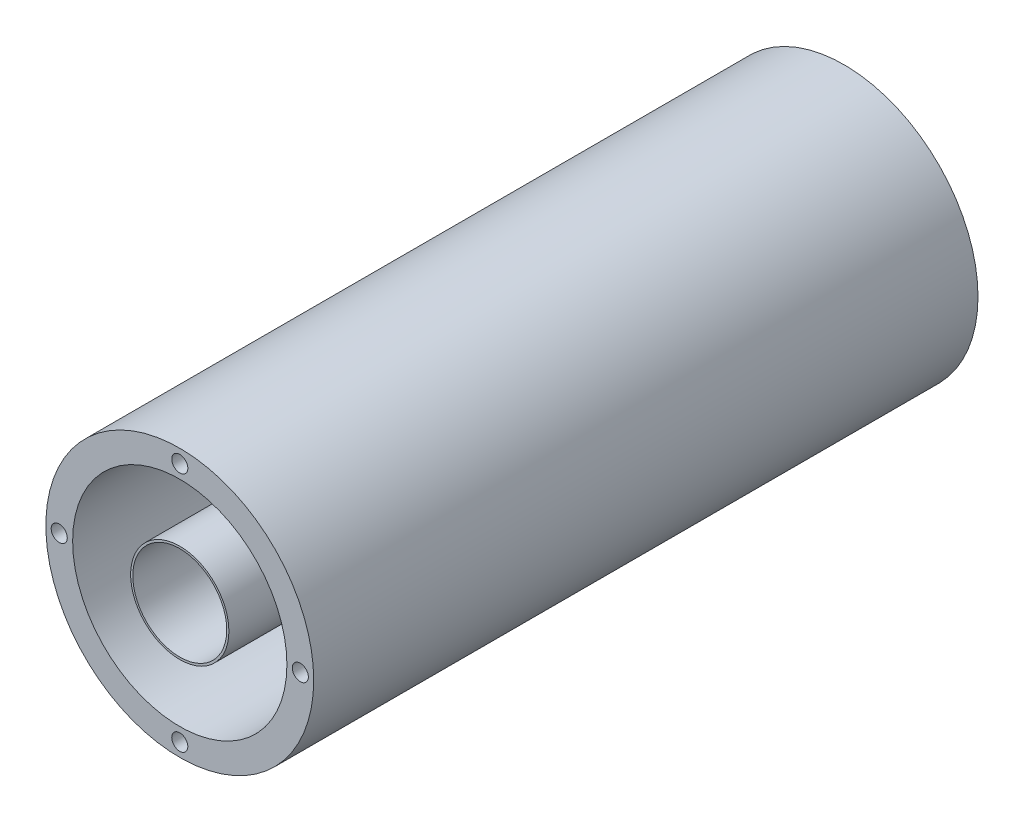
from build123d import *

# Parameters (mm, degrees)
SKETCH1_R               = 25
BOSS_EXTRUDE2_DEPTH     = 124
SKETCH3_R               = 20
CUT_EXTRUDE1_DEPTH      = 120
SKETCH4_W               = 20
SKETCH4_H               = 10
BOSS_EXTRUDE3_DEPTH     = 7
FILLET1_R               = 10
FILLET2_R               = 10
FILLET3_R               = 2
CUT_EXTRUDE2_DEPTH      = 131.003846097
CUT_EXTRUDE2_DEPTH_BACK = 131.003846097
SKETCH5_W               = 10
SKETCH5_H               = 3.1
SKETCH6_R               = 1.5
CUT_EXTRUDE3_DEPTH      = 5
CIRPATTERN1_START       = 119
CIRPATTERN1_OUTLINE_R   = 1.5
CIRPATTERN1_DEPTH       = 5
SKETCH8_R               = 9.170359624
SKETCH8_R_2             = 8.770359624
BOSS_EXTRUDE4_DEPTH     = 119.4


# Read off the part's stored shape, not the designer's step: CirPattern1
with BuildPart() as part:
    # Sketch1 → Boss-Extrude2 (new body)
    with BuildSketch(Plane.XY):
        Circle(SKETCH1_R)
    extrude(amount=BOSS_EXTRUDE2_DEPTH)

    # Sketch3 → Cut-Extrude1 (cut)
    with BuildSketch(Plane.XY.offset(124)):
        Circle(SKETCH3_R)
    extrude(amount=-CUT_EXTRUDE1_DEPTH, mode=Mode.SUBTRACT)

    # Sketch4 → Boss-Extrude3 (add)
    with BuildSketch(Plane(origin=(0, 0, 0), x_dir=(-1, 0, 0), z_dir=(0, 0, -1))):
        Rectangle(SKETCH4_W, SKETCH4_H)
    extrude(amount=BOSS_EXTRUDE3_DEPTH)

    # Fillet1
    # the kernel refuses this fillet: 10 mm, written as the material it adds along each edge
    with BuildSketch(Plane(origin=(-10, 5, 0), x_dir=(-1, 0, 0), z_dir=(0, -1, 0)), Plane(origin=(10, -5, 0), x_dir=(1, 0, 0), z_dir=(0, 1, 0))) as fillet1_piece_1:
        with BuildLine():
            CenterArc((9.539392014, 10), FILLET1_R, 197.457603124, 72.542396876)
            Line((0, 7), (-0.19078784, 6.94))
            ThreePointArc((-0.19078784, 6.94), (-0.2, 3.5), (-0.2, 0))
            Line((-0.2, 0), (0, -0.2))
            Line((0, -0.2), (9.539392014, -0.2))
            Line((9.539392014, -0.2), (9.539392014, 0))
        make_face()
    extrude(amount=10)

    # Fillet2
    fillet2_edges = [part.edges().sort_by_distance(p)[0] for p in [
        (-10, 0, -7),
        (10, 0, -7),
    ]]
    fillet(fillet2_edges, radius=FILLET2_R)

    # Fillet3
    fillet3_edges = [part.edges().sort_by_distance(p)[0] for p in [
        (0, 5, 0),
        (0, -5, 0),
    ]]
    fillet(fillet3_edges, radius=FILLET3_R)

    # Sketch5 → Cut-Extrude2 (cut, two sides: drawn at the far end of the back side and taken through both)
    with BuildSketch(Plane(origin=(0, 5, 0), x_dir=(1, 0, 0), z_dir=(0, 1, 0)).offset(-CUT_EXTRUDE2_DEPTH_BACK)):
        with Locations((0, 1.55)):
            Rectangle(SKETCH5_W, SKETCH5_H)
    extrude(amount=CUT_EXTRUDE2_DEPTH + CUT_EXTRUDE2_DEPTH_BACK, mode=Mode.SUBTRACT)

    # Sketch6 → Cut-Extrude3 (cut)
    with BuildSketch(Plane.XY.offset(124)):
        with Locations((0, 22.5)):
            Circle(SKETCH6_R)
    extrude(amount=-CUT_EXTRUDE3_DEPTH, mode=Mode.SUBTRACT)

    # CirPattern1 outline → CirPattern1 (cut)
    with BuildSketch(Plane.XY.offset(CIRPATTERN1_START)):
        with Locations((-22.5, 0)):
            Circle(CIRPATTERN1_OUTLINE_R)
        with Locations((0, -22.5)):
            Circle(CIRPATTERN1_OUTLINE_R)
        with Locations((22.5, 0)):
            Circle(CIRPATTERN1_OUTLINE_R)
    extrude(amount=CIRPATTERN1_DEPTH, mode=Mode.SUBTRACT)


with BuildPart() as body_2:
    # Sketch8 → Boss-Extrude4 (new body)
    with BuildSketch(Plane.XY.offset(124)):
        Circle(SKETCH8_R)
        Circle(SKETCH8_R_2, mode=Mode.SUBTRACT)
    extrude(amount=-BOSS_EXTRUDE4_DEPTH)


solid = Compound([part.part, body_2.part])
